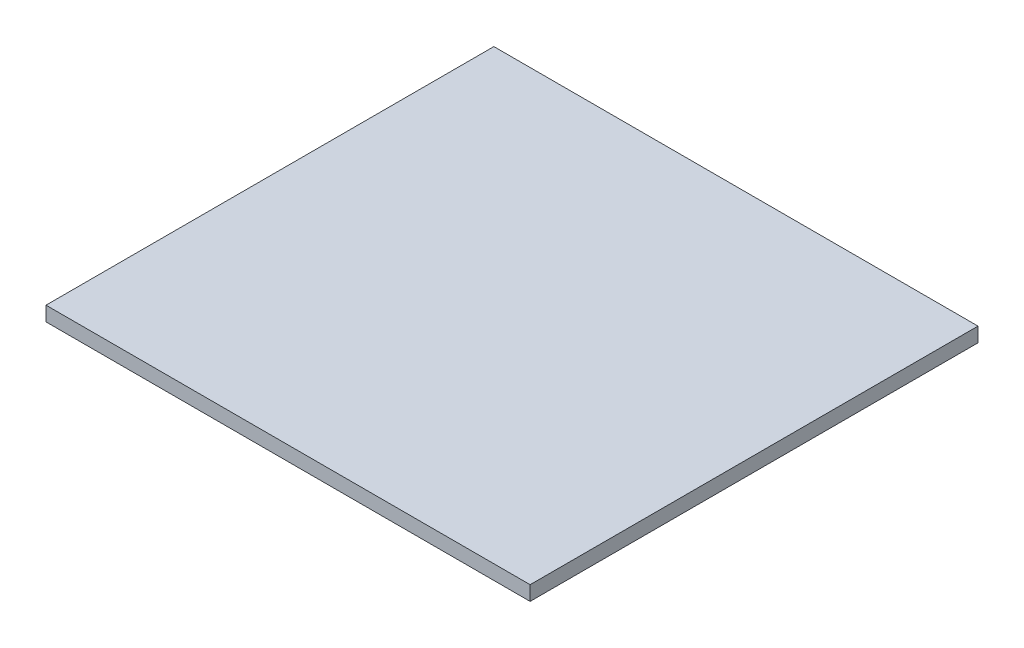
from build123d import *

# Parameters (mm, degrees)
SKETCH1_W           = 66.76
SKETCH1_H           = 61.76
BOSS_EXTRUDE3_DEPTH = 2


with BuildPart() as part:
    # Sketch1 → Boss-Extrude3 (new body)
    with BuildSketch(Plane(origin=(0, 0, 0), x_dir=(1, 0, 0), z_dir=(0, 1, 0))):
        with Locations((33.38, 30.88)):
            Rectangle(SKETCH1_W, SKETCH1_H)
    extrude(amount=BOSS_EXTRUDE3_DEPTH)


solid = part.part
